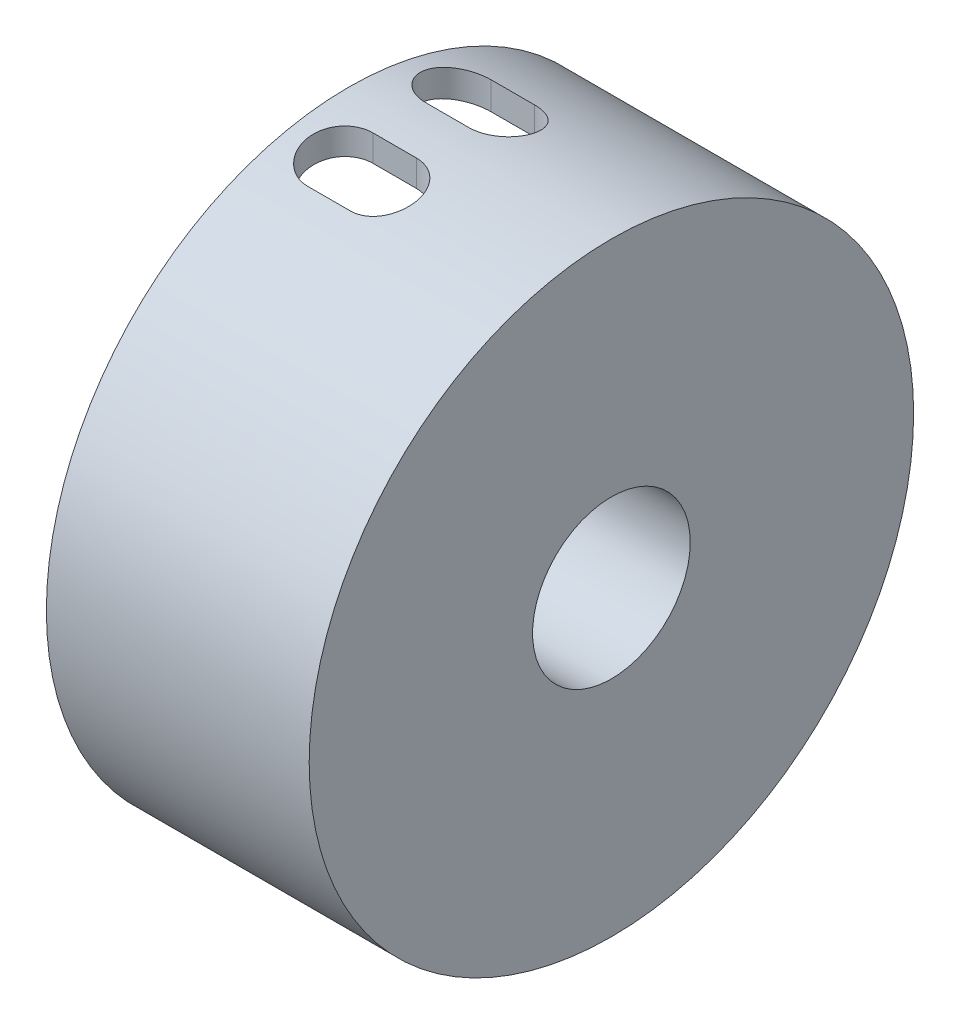
from build123d import *

# Parameters (mm, degrees)
SKETCH1_R           = 23
SKETCH1_R_2         = 21
BOSS_EXTRUDE1_DEPTH = 20
CUT_EXTRUDE1_START  = 19.798989767
CUT_EXTRUDE1_DEPTH  = 3.113888708
BOSS_EXTRUDE2_START = -1
SKETCH3_R           = 21
SKETCH3_R_2         = 6
BOSS_EXTRUDE2_DEPTH = 1
BOSS_EXTRUDE3_START = 8
SKETCH4_R           = 6
BOSS_EXTRUDE3_DEPTH = 8


# Read off the part's stored shape, not the designer's step: Cut-Extrude1
with BuildPart() as part:
    # Sketch1 → Boss-Extrude1 (new body)
    with BuildSketch(Plane(origin=(0, 0, 0), x_dir=(0, 0, -1), z_dir=(1, 0, 0))):
        Circle(SKETCH1_R)
        Circle(SKETCH1_R_2, mode=Mode.SUBTRACT)
    extrude(amount=BOSS_EXTRUDE1_DEPTH)

    # Cut-Extrude1 outline → Cut-Extrude1 (cut)
    with BuildSketch(Plane(origin=(0, 0, 0), x_dir=(1, 0, 0), z_dir=(0, 1, 0)).offset(CUT_EXTRUDE1_START)):
        with BuildLine():
            add(Edge.make_bspline(
                [(7.15, 7), (7.818022917, 7), (8.466048034, 6.72160004), (9.377693338, 5.805707302), (9.644739555, 5.166655745), (9.655100007, 3.873398622), (9.398895769, 3.221423625), (8.466344312, 2.273000364), (7.817770221, 2), (7.15, 2)],
                knots=[0, 0, 0, 0, 0.25, 0.25, 0.5, 0.5, 0.75, 0.75, 1, 1, 1, 1], degree=3))
            Line((7.15, 7), (3.85, 7))
            add(Edge.make_bspline(
                [(3.85, 7), (3.181977083, 7), (2.533951966, 6.72160004), (1.622306662, 5.805707302), (1.355260445, 5.166655745), (1.344899993, 3.873398622), (1.601104231, 3.221423625), (2.533655688, 2.273000364), (3.182229779, 2), (3.85, 2)],
                knots=[0, 0, 0, 0, 0.25, 0.25, 0.5, 0.5, 0.75, 0.75, 1, 1, 1, 1], degree=3))
            Line((3.85, 2), (7.15, 2))
        make_face()
        with BuildLine():
            Line((3.85, -7), (7.15, -7))
            add(Edge.make_bspline(
                [(7.15, -7), (7.818022917, -7), (8.466048034, -6.72160004), (9.377693338, -5.805707302), (9.644739555, -5.166655745), (9.655100007, -3.873398622), (9.398895769, -3.221423625), (8.466344312, -2.273000364), (7.817770221, -2), (7.15, -2)],
                knots=[0, 0, 0, 0, 0.25, 0.25, 0.5, 0.5, 0.75, 0.75, 1, 1, 1, 1], degree=3))
            Line((7.15, -2), (3.85, -2))
            add(Edge.make_bspline(
                [(3.85, -7), (3.181977083, -7), (2.533951966, -6.72160004), (1.622306662, -5.805707302), (1.355260445, -5.166655745), (1.344899993, -3.873398622), (1.601104231, -3.221423625), (2.533655688, -2.273000364), (3.182229779, -2), (3.85, -2)],
                knots=[0, 0, 0, 0, 0.25, 0.25, 0.5, 0.5, 0.75, 0.75, 1, 1, 1, 1], degree=3))
        make_face()
    extrude(amount=CUT_EXTRUDE1_DEPTH, mode=Mode.SUBTRACT)

    # Sketch3 → Boss-Extrude2 (add)
    with BuildSketch(Plane(origin=(20, 0, 0), x_dir=(0, 0, -1), z_dir=(1, 0, 0)).offset(BOSS_EXTRUDE2_START)):
        Circle(SKETCH3_R)
        Circle(SKETCH3_R_2, mode=Mode.SUBTRACT)
    extrude(amount=BOSS_EXTRUDE2_DEPTH)

    # Sketch4 → Boss-Extrude3 (add)
    with BuildSketch(Plane.ZY.offset(-19).offset(BOSS_EXTRUDE3_START)):
        with BuildLine():
            Line((7.937253933, -1), (20.976176963, -1))
            ThreePointArc((20.976176963, -1), (21, 0), (20.976176963, 1))
            Line((20.976176963, 1), (7.937253933, 1))
            ThreePointArc((7.937253933, 1), (5.656854249, 5.656854249), (1, 7.937253933))
            Line((1, 7.937253933), (1, 20.976176963))
            ThreePointArc((1, 20.976176963), (0, 21), (-1, 20.976176963))
            Line((-1, 20.976176963), (-1, 7.937253933))
            ThreePointArc((-1, 7.937253933), (-5.656854249, 5.656854249), (-7.937253933, 1))
            Line((-7.937253933, 1), (-20.976176963, 1))
            ThreePointArc((-20.976176963, 1), (-21, 0), (-20.976176963, -1))
            Line((-20.976176963, -1), (-7.937253933, -1))
            ThreePointArc((-7.937253933, -1), (-5.656854249, -5.656854249), (-1, -7.937253933))
            Line((-1, -7.937253933), (-1, -20.976176963))
            ThreePointArc((-1, -20.976176963), (0, -21), (1, -20.976176963))
            Line((1, -20.976176963), (1, -7.937253933))
            ThreePointArc((1, -7.937253933), (5.656854249, -5.656854249), (7.937253933, -1))
        make_face()
        with Locations(Location((0, 0, 0), (0, 0, 180))):
            Circle(SKETCH4_R, mode=Mode.SUBTRACT)
    extrude(amount=-BOSS_EXTRUDE3_DEPTH)


solid = part.part
